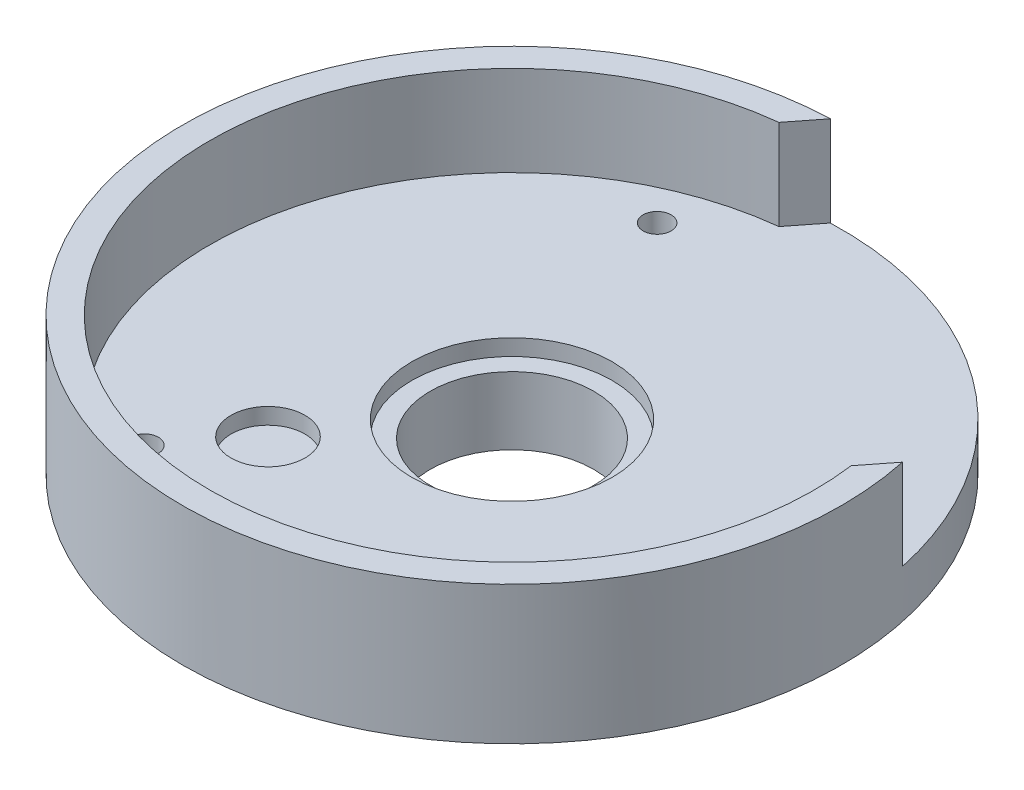
from build123d import *

# Parameters (mm, degrees)
SKETCH_1_R          = 36.5
EXTRUDE_1_DEPTH     = 5.3
SKETCH_2_R          = 36.5
SKETCH_2_R_2        = 33.5
EXTRUDE_1_2_DEPTH   = 10
SKETCH_4_R          = 4.1
EXTRUDE_3_DEPTH     = 5
SKETCH_5_R          = 4.1
EXTRUDE_4_DEPTH     = 3.5
CUT_EXTRUDE_1_DEPTH = 10
SKETCH_8_R          = 12
EXTRUDE_7_DEPTH     = 3.5
SKETCH_9_R          = 11
SKETCH_9_R_2        = 9.05
EXTRUDE_8_DEPTH     = 4
CUT_EXTRUDE_START   = -10
SKETCH_10_R         = 9.05
CUT_EXTRUDE_2_DEPTH = 10
SKETCH_11_R         = 1.55
CUT_EXTRUDE_3_DEPTH = 53.636394253


with BuildPart() as part:
    # 草图1 → Extrude 1 (new body)
    with BuildSketch(Plane(origin=(0, 0, 0), x_dir=(1, 0, 0), z_dir=(0, 1, 0))):
        Circle(SKETCH_1_R)
        with BuildLine():
            ThreePointArc((-7.772537517, -15.152734173), (-15.558840193, -16.947496714), (-9.343841215, -11.925398583))
            ThreePointArc((-9.343841215, -11.925398583), (-8.186234841, -13.357971631), (-7.772537517, -15.152734173))
        make_face(mode=Mode.SUBTRACT)
        with BuildLine():
            ThreePointArc((11.1, 0), (4.858991271, -9.979990172), (-6.845982672, -8.737420744))
            ThreePointArc((-6.845982672, -8.737420744), (-4.858991271, 9.979990172), (11.1, 0))
        make_face(mode=Mode.SUBTRACT)
    extrude(amount=EXTRUDE_1_DEPTH)

    # 草图2 → Extrude 1 2 (add)
    with BuildSketch(Plane(origin=(0, 5.3, 0), x_dir=(1, 0, 0), z_dir=(0, 1, 0))):
        Circle(SKETCH_2_R)
        Circle(SKETCH_2_R_2, mode=Mode.SUBTRACT)
    extrude(amount=EXTRUDE_1_2_DEPTH)



with BuildPart() as body_2:
    # 草图4 → 凸台-拉伸3 (new body)
    with BuildSketch(Plane.XZ):
        with Locations((-11.872537517, 15.152734173)):
            Circle(SKETCH_4_R)
    extrude(amount=EXTRUDE_3_DEPTH)


with BuildPart() as part_1:
    add(part.part)

    add(body_2.part)  # 凸台-拉伸4 merges body 2
    # 草图5 → 凸台-拉伸4 (add)
    with BuildSketch(Plane(origin=(0, 0, 0), x_dir=(1, 0, 0), z_dir=(0, 1, 0))):
        with Locations((-11.872537517, -15.152734173)):
            Circle(SKETCH_5_R)
    extrude(amount=EXTRUDE_4_DEPTH)

    # 草图6 → 切除-拉伸1 (cut)
    with BuildSketch(Plane(origin=(0, 5.3, 0), x_dir=(1, 0, 0), z_dir=(0, 1, 0))):
        Polygon((0, 0), (30.542099638, 6.447606501), (33.216045924, 4.352504242), (44.964219504, 19.346514664), (8.028154367, 48.286824318), (-3.720019212, 33.292813895), (-1.046072926, 31.197711636), align=None)
    extrude(amount=CUT_EXTRUDE_1_DEPTH, mode=Mode.SUBTRACT)

    # 草图8 → 凸台-拉伸7 (add)
    with BuildSketch(Plane.XZ):
        Circle(SKETCH_8_R)
    extrude(amount=-EXTRUDE_7_DEPTH)

    # 草图9 → 凸台-拉伸8 (add)
    with BuildSketch(Plane.XZ):
        Circle(SKETCH_9_R)
        Circle(SKETCH_9_R_2, mode=Mode.SUBTRACT)
    extrude(amount=EXTRUDE_8_DEPTH)

    # 草图10 → 切除-拉伸2 (cut)
    with BuildSketch(Plane.XZ.offset(4).offset(CUT_EXTRUDE_START)):
        Circle(SKETCH_10_R)
    extrude(amount=CUT_EXTRUDE_2_DEPTH, mode=Mode.SUBTRACT)

    # 草图11 → 切除-拉伸3 (cut, through all)
    with BuildSketch(Plane(origin=(0, 5.3, 0), x_dir=(1, 0, 0), z_dir=(0, 1, 0))):
        with Locations((-17.885900675, -22.827495637)):
            Circle(SKETCH_11_R)
        with Locations((-10.826240789, 26.903392172)):
            Circle(SKETCH_11_R)
        with Locations((28.712141464, -4.075896535)):
            Circle(SKETCH_11_R)
    extrude(amount=-CUT_EXTRUDE_3_DEPTH, mode=Mode.SUBTRACT)


solid = part_1.part
